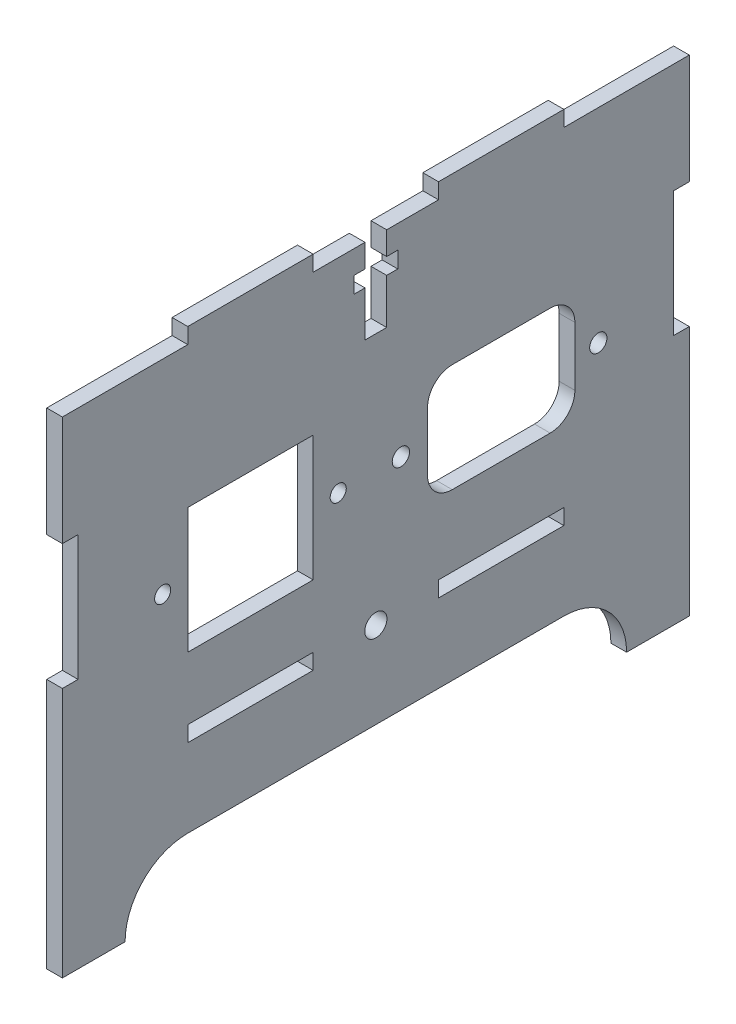
from build123d import *

# Parameters (mm, degrees)
SKETCH1_W                 = 127
SKETCH1_H                 = 101.6
BOSS_EXTRUDE1_DEPTH       = 3.175
SKETCH2_W                 = 25.4
SKETCH2_H                 = 3.175
CUT_EXTRUDE1_DEPTH        = 6.35
LPATTERN1_COUNT           = 3
LPATTERN1_PITCH           = 50.8
CUT_EXTRUDE4_DEPTH        = 6.35
SKETCH8_W                 = 3.175
SKETCH8_H                 = 25.4
CUT_EXTRUDE6_DEPTH        = 6.35
SKETCH9_W                 = 25.4
SKETCH9_H                 = 3.175
CUT_EXTRUDE7_DEPTH        = 6.35
LPATTERN6_COUNT           = 2
LPATTERN6_PITCH           = 50.8
SKETCH16_W                = 4.3942
SKETCH16_H                = 17.145
SKETCH16_W_2              = 8.89
SKETCH16_H_2              = 3.302
CUT_EXTRUDE14_DEPTH       = 6.35
F_8_CLEARANCE_HOLE1_D     = 4.4958
F_8_CLEARANCE_HOLE1_DEPTH = 10.16
F_8_CLEARANCE_HOLE1_TIP   = 1.350674586
SKETCH20_R                = 1.75
CUT_EXTRUDE16_DEPTH       = 7.62
SKETCH25_W                = 25.4
SKETCH25_H                = 25.4
CUT_EXTRUDE20_DEPTH       = 7.62
F_4_CLEARANCE_HOLE1_D     = 3.2639
F_4_CLEARANCE_HOLE1_DEPTH = 10.16
F_4_CLEARANCE_HOLE1_TIP   = 0.980574487


with BuildPart() as part:
    # Sketch1 → Boss-Extrude1 (new body)
    with BuildSketch(Plane(origin=(0, 0, 0), x_dir=(0, 0, -1), z_dir=(1, 0, 0))):
        Rectangle(SKETCH1_W, SKETCH1_H)
    extrude(amount=BOSS_EXTRUDE1_DEPTH)

    # Sketch2 → Cut-Extrude1 (cut)
    with BuildSketch(Plane(origin=(3.175, 0, 0), x_dir=(0, 0, -1), z_dir=(1, 0, 0))):
        with Locations((-50.8, 49.2125)):
            Rectangle(SKETCH2_W, SKETCH2_H)
    cut_extrude1 = extrude(amount=-CUT_EXTRUDE1_DEPTH, mode=Mode.SUBTRACT)

    # LPattern1: Cut-Extrude1 ×3
    with Locations(*[(0, 0, -i * LPATTERN1_PITCH) for i in range(1, LPATTERN1_COUNT)]):
        add(cut_extrude1, mode=Mode.SUBTRACT)

    # Sketch5 → Cut-Extrude4 (cut)
    with BuildSketch(Plane(origin=(3.175, 0, 0), x_dir=(0, 0, -1), z_dir=(1, 0, 0))):
        with BuildLine():
            Line((-38.1, -38.1), (38.1, -38.1))
            ThreePointArc((38.1, -38.1), (50.8, -50.8), (38.1, -63.5))
            Line((38.1, -63.5), (-38.1, -63.5))
            ThreePointArc((-38.1, -63.5), (-50.8, -50.8), (-38.1, -38.1))
        make_face()
    extrude(amount=-CUT_EXTRUDE4_DEPTH, mode=Mode.SUBTRACT)

    # Sketch8 → Cut-Extrude6 (cut)
    with BuildSketch(Plane(origin=(3.175, 0, 0), x_dir=(0, 0, -1), z_dir=(1, 0, 0))):
        with Locations((61.9125, 12.7)):
            Rectangle(SKETCH8_W, SKETCH8_H)
    cut_extrude6 = extrude(amount=-CUT_EXTRUDE6_DEPTH, mode=Mode.SUBTRACT)

    # Sketch9 → Cut-Extrude7 (cut)
    with BuildSketch(Plane.ZY):
        with Locations((-25.4, -20.6375)):
            Rectangle(SKETCH9_W, SKETCH9_H)
    cut_extrude7 = extrude(amount=-CUT_EXTRUDE7_DEPTH, mode=Mode.SUBTRACT)

    # LPattern6: Cut-Extrude7 ×2
    with Locations(*[(0, 0, i * LPATTERN6_PITCH) for i in range(1, LPATTERN6_COUNT)]):
        add(cut_extrude7, mode=Mode.SUBTRACT)

    # Sketch16 → Cut-Extrude14 (cut)
    with BuildSketch(Plane.ZY):
        with Locations((0, 39.0525)):
            Rectangle(SKETCH16_W, SKETCH16_H)
        with Locations((0, 41.275)):
            Rectangle(SKETCH16_W_2, SKETCH16_H_2)
    extrude(amount=-CUT_EXTRUDE14_DEPTH, mode=Mode.SUBTRACT)

    # #8 Clearance Hole1
    with Locations(Plane.ZY):
        with Locations((0, -20.6375)):
            Hole(F_8_CLEARANCE_HOLE1_D / 2, depth=F_8_CLEARANCE_HOLE1_DEPTH)
            with Locations((0, 0, -(F_8_CLEARANCE_HOLE1_DEPTH + F_8_CLEARANCE_HOLE1_TIP / 2))):  # 118° drill point
                Cone(0, F_8_CLEARANCE_HOLE1_D / 2, F_8_CLEARANCE_HOLE1_TIP, mode=Mode.SUBTRACT)

    # Sketch20 → Cut-Extrude16 (cut)
    with BuildSketch(Plane.ZY):
        with Locations((-45.0725, 6.35)):
            Circle(SKETCH20_R)
        with Locations((-5.0725, 6.35)):
            Circle(SKETCH20_R)
        with BuildLine():
            Line((-35.3225, 17.3101), (-15.4775, 17.3101))
            ThreePointArc((-15.4775, 17.3101), (-11.941966094, 15.845633906), (-10.4775, 12.3101))
            Line((-10.4775, 12.3101), (-10.4775, 0.3899))
            ThreePointArc((-10.4775, 0.3899), (-11.941966094, -3.145633906), (-15.4775, -4.6101))
            Line((-15.4775, -4.6101), (-35.3225, -4.6101))
            ThreePointArc((-35.3225, -4.6101), (-38.858033906, -3.145633906), (-40.3225, 0.3899))
            Line((-40.3225, 0.3899), (-40.3225, 12.3101))
            ThreePointArc((-40.3225, 12.3101), (-38.858033906, 15.845633906), (-35.3225, 17.3101))
        make_face()
    extrude(amount=-CUT_EXTRUDE16_DEPTH, mode=Mode.SUBTRACT)

    # Sketch25 → Cut-Extrude20 (cut)
    with BuildSketch(Plane.ZY):
        with Locations((25.4, 6.35)):
            Rectangle(SKETCH25_W, SKETCH25_H)
    extrude(amount=-CUT_EXTRUDE20_DEPTH, mode=Mode.SUBTRACT)

    # Mirror3: Cut-Extrude6 across plane
    add(cut_extrude6.mirror(Plane.XY), mode=Mode.SUBTRACT)

    # #4 Clearance Hole1
    with Locations(Plane(origin=(3.175, 0, 0), x_dir=(0, 0, -1), z_dir=(1, 0, 0))):
        with Locations((-43.18, 6.35), (-7.62, 6.35)):
            Hole(F_4_CLEARANCE_HOLE1_D / 2, depth=F_4_CLEARANCE_HOLE1_DEPTH)
            with Locations((0, 0, -(F_4_CLEARANCE_HOLE1_DEPTH + F_4_CLEARANCE_HOLE1_TIP / 2))):  # 118° drill point
                Cone(0, F_4_CLEARANCE_HOLE1_D / 2, F_4_CLEARANCE_HOLE1_TIP, mode=Mode.SUBTRACT)


solid = part.part
